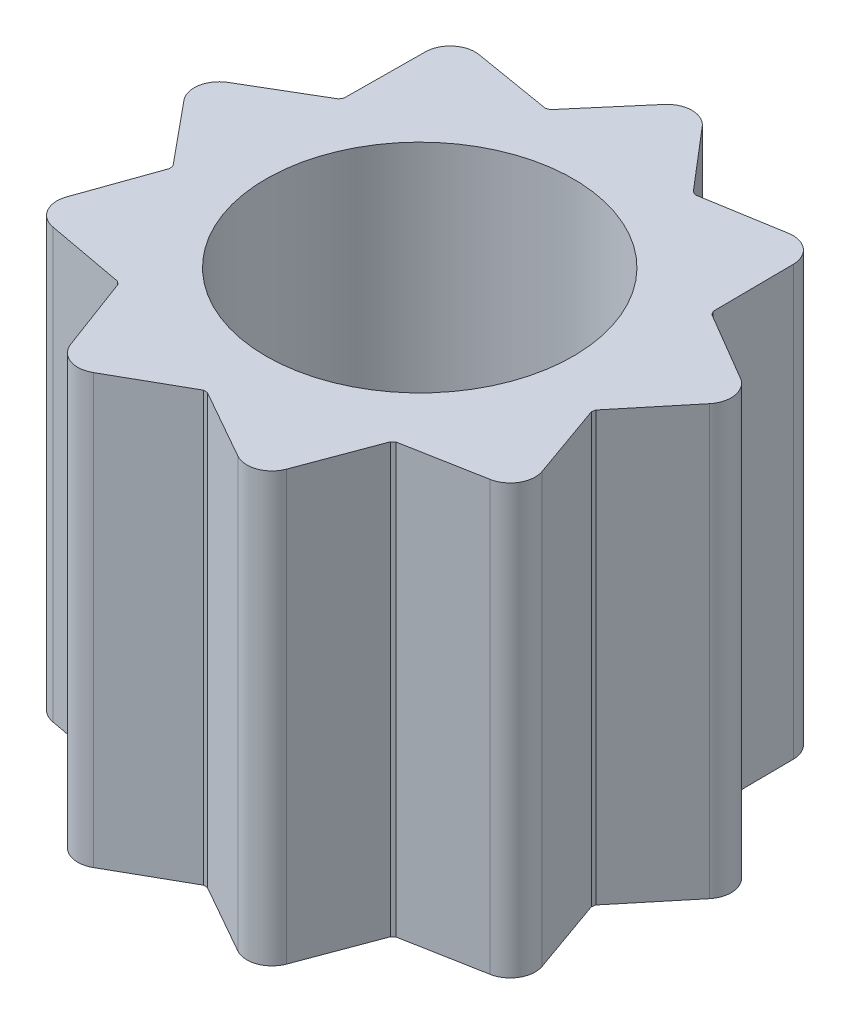
from build123d import *

# Parameters (mm, degrees)
SKETCH1_R           = 2.15
BOSS_EXTRUDE1_DEPTH = 6
FILLET1_R           = 0.35


with BuildPart() as part:
    # Sketch1 → Boss-Extrude1 (new body)
    with BuildSketch(Plane(origin=(0, 0, 0), x_dir=(1, 0, 0), z_dir=(0, 1, 0))):
        with BuildLine():
            Line((1, 2.828427125), (0, 4))
            Line((0, 4), (-1, 2.828427125))
            ThreePointArc((-1, 2.828427125), (-1.02606043, 2.819077862), (-1.052033468, 2.809488491))
            Line((-1.052033468, 2.809488491), (-2.571150439, 3.064177772))
            Line((-2.571150439, 3.064177772), (-2.584122354, 1.523913272))
            ThreePointArc((-2.584122354, 1.523913272), (-2.598076211, 1.5), (-2.611808784, 1.475958969))
            Line((-2.611808784, 1.475958969), (-3.939231012, 0.694592711))
            Line((-3.939231012, 0.694592711), (-2.959105139, -0.493656537))
            ThreePointArc((-2.959105139, -0.493656537), (-2.954423259, -0.520944533), (-2.949489743, -0.548188159))
            Line((-2.949489743, -0.548188159), (-3.464101615, -2))
            Line((-3.464101615, -2), (-1.949489743, -2.280238966))
            ThreePointArc((-1.949489743, -2.280238966), (-1.928362829, -2.298133329), (-1.907071671, -2.315831954))
            Line((-1.907071671, -2.315831954), (-1.368080573, -3.758770483))
            Line((-1.368080573, -3.758770483), (-0.02768643, -2.999872241))
            ThreePointArc((-0.02768643, -2.999872241), (0, -3), (0.02768643, -2.999872241))
            Line((0.02768643, -2.999872241), (1.368080573, -3.758770483))
            Line((1.368080573, -3.758770483), (1.907071671, -2.315831954))
            ThreePointArc((1.907071671, -2.315831954), (1.928362829, -2.298133329), (1.949489743, -2.280238966))
            Line((1.949489743, -2.280238966), (3.464101615, -2))
            Line((3.464101615, -2), (2.949489743, -0.548188159))
            ThreePointArc((2.949489743, -0.548188159), (2.954423259, -0.520944533), (2.959105139, -0.493656537))
            Line((2.959105139, -0.493656537), (3.939231012, 0.694592711))
            Line((3.939231012, 0.694592711), (2.611808784, 1.475958969))
            ThreePointArc((2.611808784, 1.475958969), (2.598076211, 1.5), (2.584122354, 1.523913272))
            Line((2.584122354, 1.523913272), (2.571150439, 3.064177772))
            Line((2.571150439, 3.064177772), (1.052033468, 2.809488491))
            ThreePointArc((1.052033468, 2.809488491), (1.02606043, 2.819077862), (1, 2.828427125))
        make_face()
        Circle(SKETCH1_R, mode=Mode.SUBTRACT)
    extrude(amount=BOSS_EXTRUDE1_DEPTH)

    # Fillet1
    fillet1_edges = [part.edges().sort_by_distance(p)[0] for p in [
        (2.571150439, 3, -3.064177772),
        (3.939231012, 3, -0.694592711),
        (3.464101615, 3, 2),
        (0, 3, -4),
        (-1.368080573, 3, 3.758770483),
        (1.368080573, 3, 3.758770483),
        (-2.571150439, 3, -3.064177772),
        (-3.464101615, 3, 2),
        (-3.939231012, 3, -0.694592711),
    ]]
    fillet(fillet1_edges, radius=FILLET1_R)


solid = part.part
